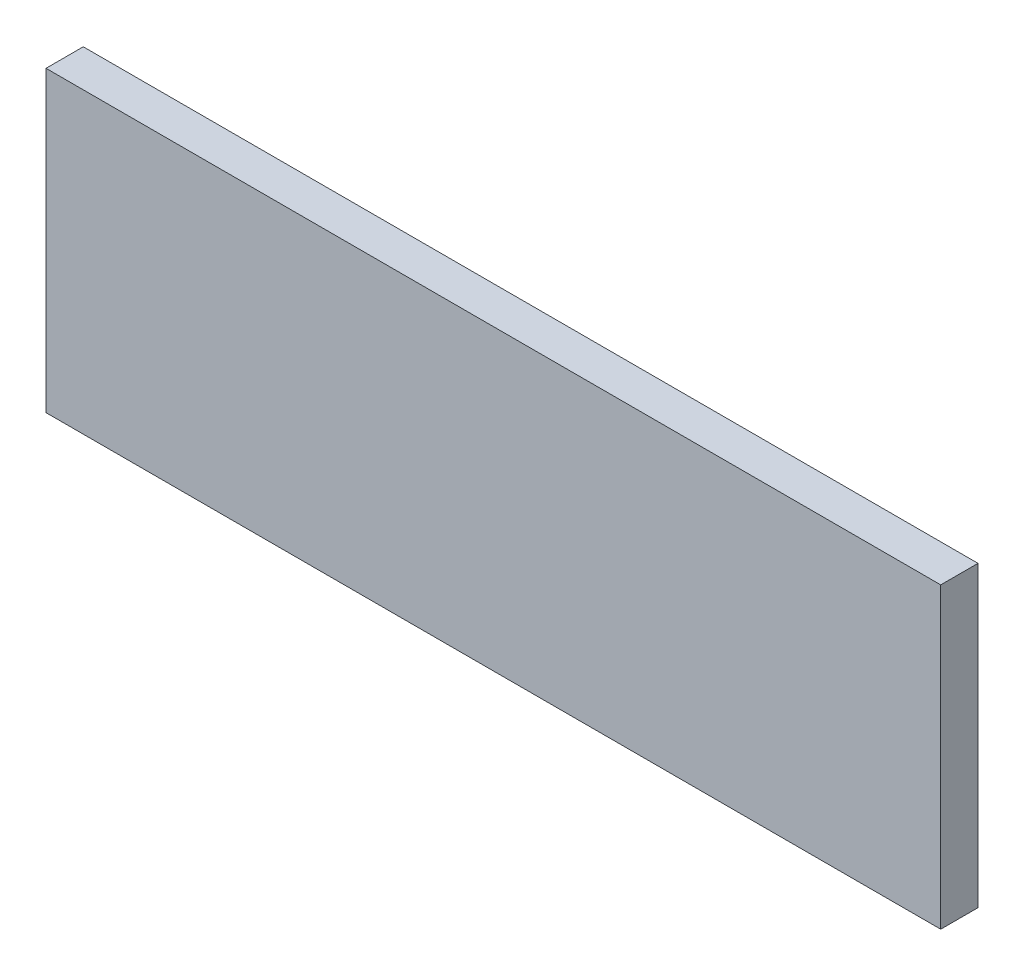
from build123d import *

# Parameters (mm, degrees)
SKETCH1_W           = 304.8
SKETCH1_H           = 101.6
BOSS_EXTRUDE1_DEPTH = 12.7


with BuildPart() as part:
    # Sketch1 → Boss-Extrude1 (new body)
    with BuildSketch(Plane.XY):
        with Locations((152.4, -50.8)):
            Rectangle(SKETCH1_W, SKETCH1_H)
    extrude(amount=BOSS_EXTRUDE1_DEPTH)


solid = part.part
